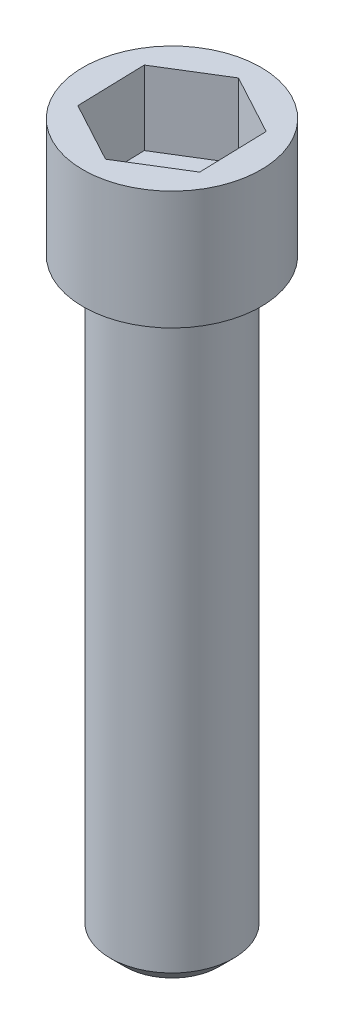
from build123d import *

# Parameters (mm, degrees)
SKETCH1_R           = 1.04
BOSS_EXTRUDE1_DEPTH = 10
SKETCH2_R           = 1.5
BOSS_EXTRUDE2_DEPTH = 2
CUT_EXTRUDE1_DEPTH  = 1.25
CHAMFER1_SIZE       = 0.25


with BuildPart() as part:
    # Sketch1 → Boss-Extrude1 (new body)
    with BuildSketch(Plane(origin=(0, 0, 0), x_dir=(1, 0, 0), z_dir=(0, 1, 0))):
        Circle(SKETCH1_R)
    extrude(amount=BOSS_EXTRUDE1_DEPTH)

    # Sketch2 → Boss-Extrude2 (add)
    with BuildSketch(Plane(origin=(0, 10, 0), x_dir=(1, 0, 0), z_dir=(0, 1, 0))):
        Circle(SKETCH2_R)
    extrude(amount=BOSS_EXTRUDE2_DEPTH)

    # Sketch3 → Cut-Extrude1 (cut)
    with BuildSketch(Plane(origin=(0, 12, 0), x_dir=(1, 0, 0), z_dir=(0, 1, 0))):
        Polygon((-0.032777471, 1.154235232), (-1.015985768, 0.548731493), (-0.983208297, -0.605503739), (0.032777471, -1.154235232), (1.015985768, -0.548731493), (0.983208297, 0.605503739), align=None)
    extrude(amount=-CUT_EXTRUDE1_DEPTH, mode=Mode.SUBTRACT)

    # Chamfer1
    chamfer1_edges = [part.edges().sort_by_distance(p)[0] for p in [
        (-1.04, 0, 0),
    ]]
    chamfer(chamfer1_edges, length=CHAMFER1_SIZE)


solid = part.part
